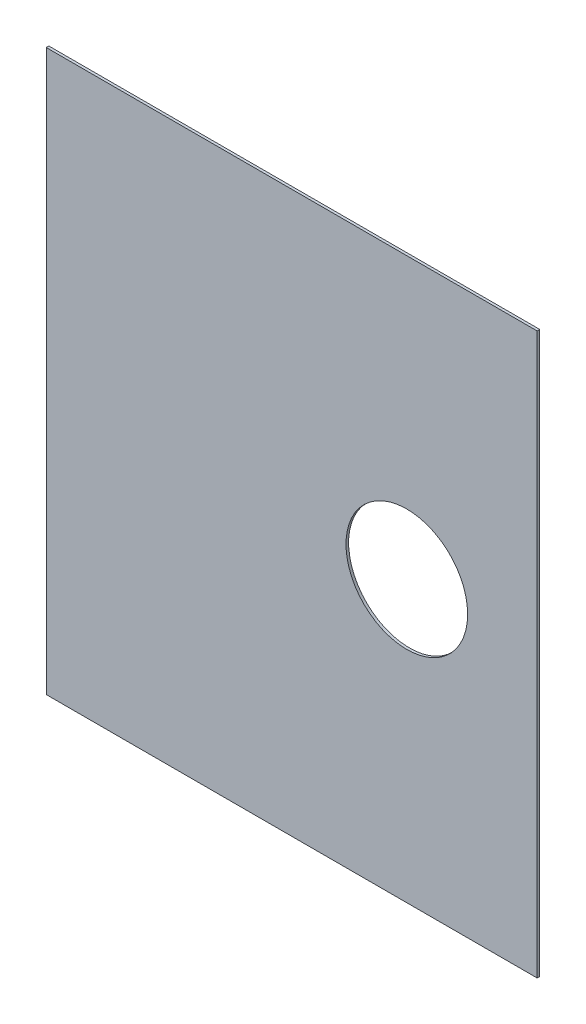
from build123d import *

# Parameters (mm, degrees)
SKICA1_W                = 565
SKICA1_H                = 645
SKICA1_R                = 70
P_IDAT_VYSUNUT_M1_DEPTH = 3


with BuildPart() as part:
    # Skica1 → Přidat vysunutím1 (new body)
    with BuildSketch(Plane.XY):
        Rectangle(SKICA1_W, SKICA1_H)
        with Locations((132.5, 0)):
            Circle(SKICA1_R, mode=Mode.SUBTRACT)
    extrude(amount=P_IDAT_VYSUNUT_M1_DEPTH)


solid = part.part
